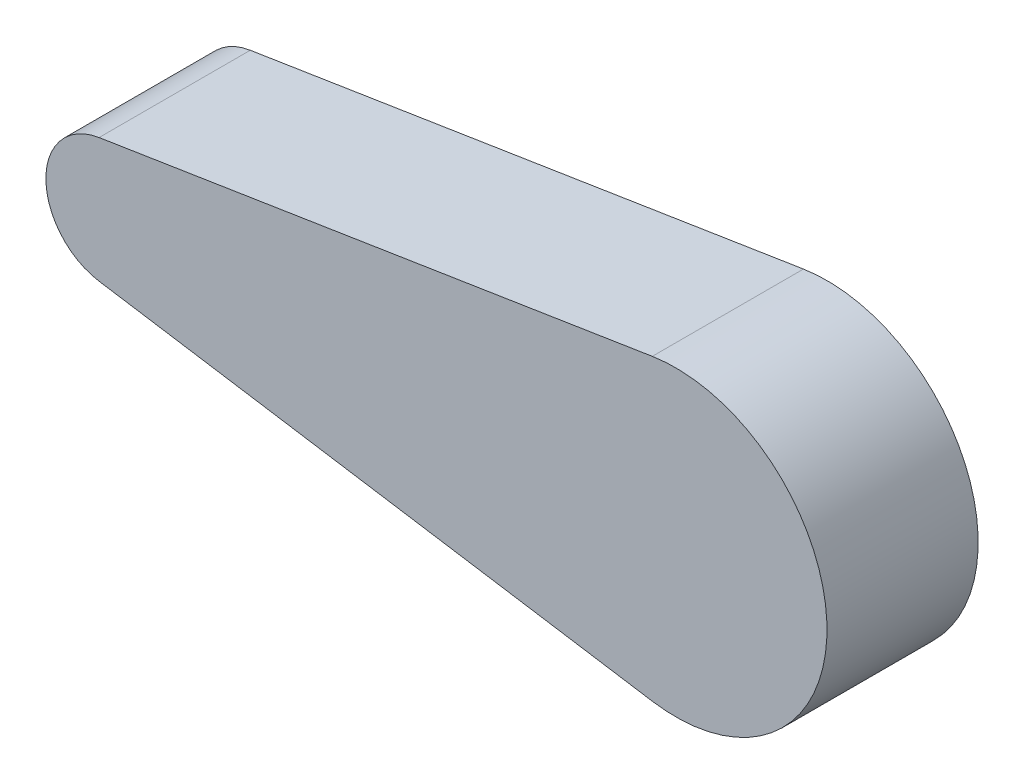
from build123d import *
from build123d.topology import SkipClean

# Parameters (mm, degrees)
BOSS_EXTRUDE1_DEPTH = 2
BOSS_EXTRUDE2_START = 4
BOSS_EXTRUDE2_DEPTH = 4


with BuildPart() as part:
    # Sketch1 → Boss-Extrude1 (new body)
    with BuildSketch(Plane.XY):
        with BuildLine():
            Line((-22.888888889, -2.469567863), (-0.933333333, -5.926962872))
            ThreePointArc((-0.933333333, -5.926962872), (6, 0), (-0.933333333, 5.926962872))
            Line((-0.933333333, 5.926962872), (-22.888888889, 2.469567863))
            ThreePointArc((-22.888888889, 2.469567863), (-25, 0), (-22.888888889, -2.469567863))
        make_face()
    extrude(amount=BOSS_EXTRUDE1_DEPTH)

    # Sketch2 → Boss-Extrude2 (add)
    with SkipClean():  # the faces are left unmerged after this step: merging them gives an invalid solid
        with BuildSketch(Plane(origin=(0, 0, 0), x_dir=(-1, 0, 0), z_dir=(0, 0, -1)).offset(BOSS_EXTRUDE2_START)):
            with BuildLine():
                Line((22.888888889, 2.469567863), (0.933333333, 5.926962872))
                ThreePointArc((0.933333333, 5.926962872), (-6, 0), (0.933333333, -5.926962872))
                Line((0.933333333, -5.926962872), (22.888888889, -2.469567863))
                ThreePointArc((22.888888889, -2.469567863), (25, 0), (22.888888889, 2.469567863))
            make_face()
            with BuildLine():
                Line((14.175490262, 2.296574012), (2.322474144, 2.944250983))
                ThreePointArc((2.322474144, 2.944250983), (-3.75, 0), (2.322474144, -2.944250983))
                Line((2.322474144, -2.944250983), (14.175490262, -2.296574012))
                ThreePointArc((14.175490262, -2.296574012), (16.35, 0), (14.175490262, 2.296574012))
            make_face(mode=Mode.SUBTRACT)
        extrude(amount=-BOSS_EXTRUDE2_DEPTH)


solid = part.part
